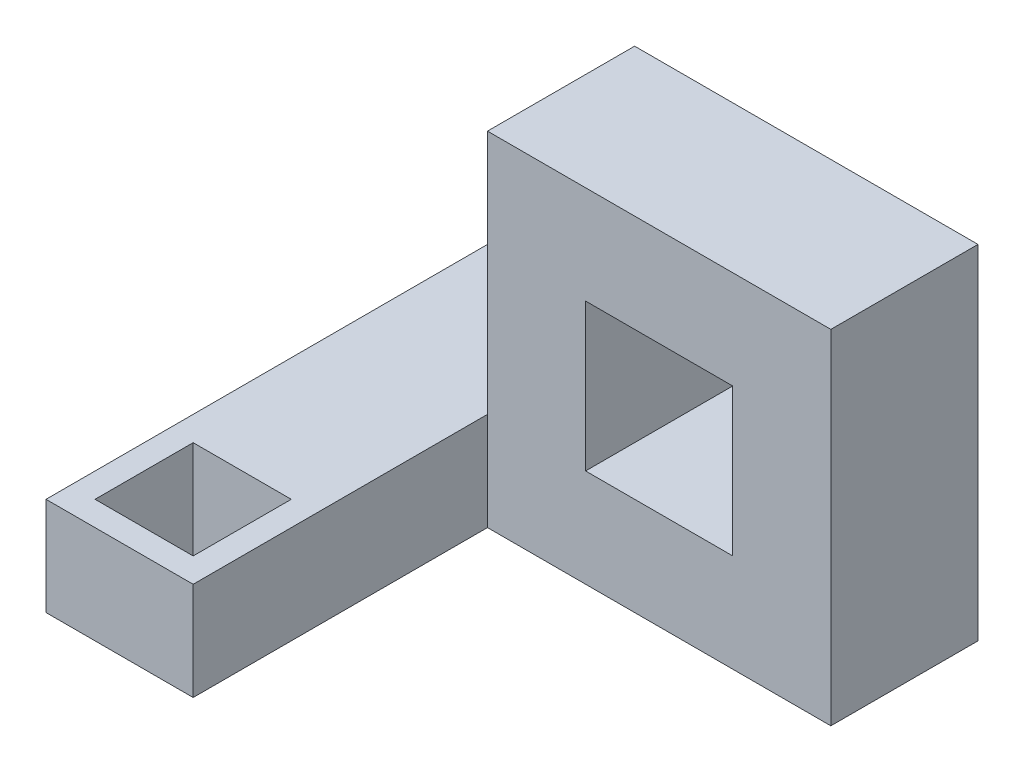
from build123d import *

# Parameters (mm, degrees)
SKETCH1_W           = 35
SKETCH1_H           = 35
BOSS_EXTRUDE1_DEPTH = 15
SKETCH2_W           = 15
SKETCH2_H           = 15
CUT_EXTRUDE1_DEPTH  = 54
SKETCH4_W           = 15
SKETCH4_H           = 9.997912834
BOSS_EXTRUDE2_DEPTH = 45
SKETCH5_W           = 10
SKETCH5_H           = 10
CUT_EXTRUDE2_DEPTH  = 45


with BuildPart() as part:
    # Sketch1 → Boss-Extrude1 (new body)
    with BuildSketch(Plane.XY):
        Rectangle(SKETCH1_W, SKETCH1_H)
    extrude(amount=BOSS_EXTRUDE1_DEPTH)

    # Sketch2 → Cut-Extrude1 (cut)
    with BuildSketch(Plane.XY.offset(15)):
        Rectangle(SKETCH2_W, SKETCH2_H)
    extrude(amount=-CUT_EXTRUDE1_DEPTH, mode=Mode.SUBTRACT)

    # Sketch4 → Boss-Extrude2 (add)
    with BuildSketch(Plane(origin=(0, 0, 0), x_dir=(-1, 0, 0), z_dir=(0, 0, -1))):
        with Locations((25, -12.501043583)):
            Rectangle(SKETCH4_W, SKETCH4_H)
    extrude(amount=-BOSS_EXTRUDE2_DEPTH)

    # Sketch5 → Cut-Extrude2 (cut)
    with BuildSketch(Plane.XZ.offset(17.5)):
        with Locations((-25, 37.5)):
            Rectangle(SKETCH5_W, SKETCH5_H)
    extrude(amount=-CUT_EXTRUDE2_DEPTH, mode=Mode.SUBTRACT)


solid = part.part
